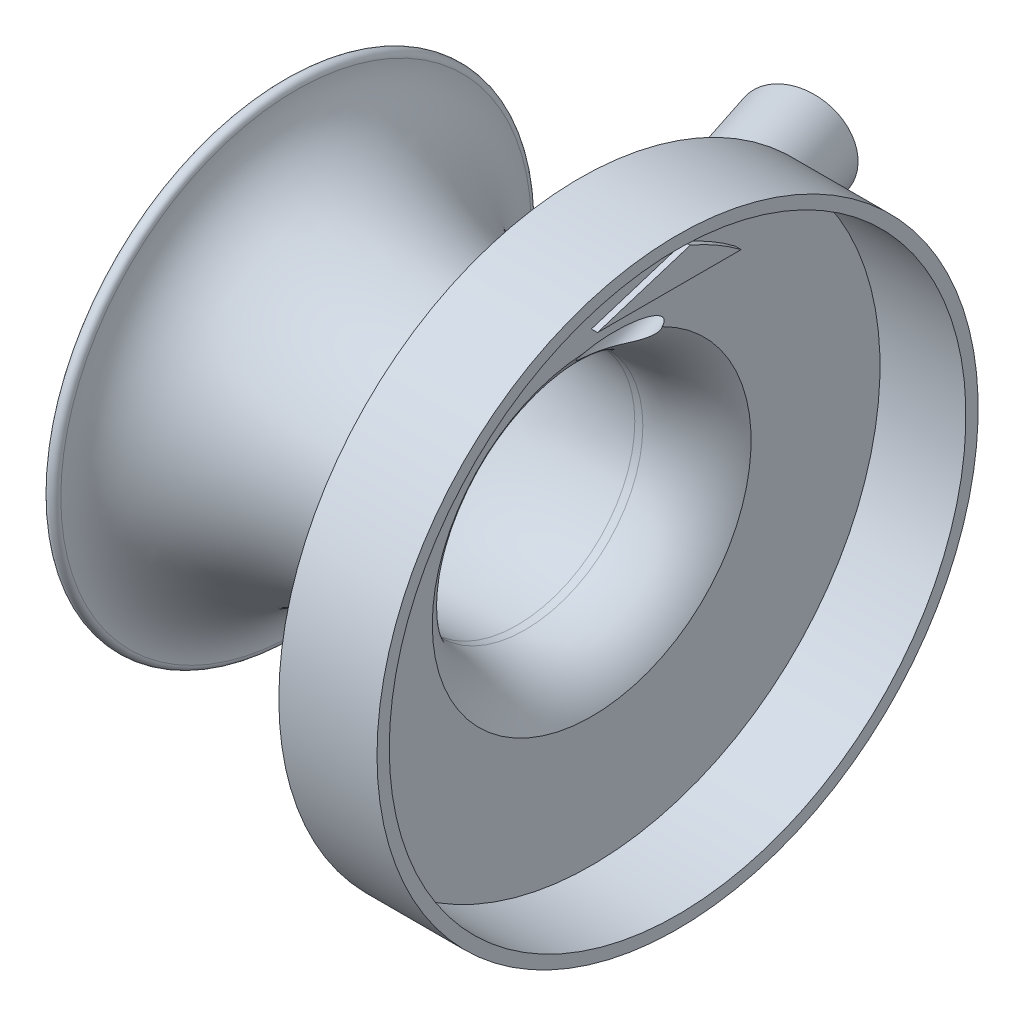
from build123d import *

# Parameters (mm, degrees)
BOSS_EXTRUDE1_REACH      = 140.716
SKETCH2_R                = 5.55625
SKETCH2_R_2              = 3.175
CUT_EXTRUDE1_DEPTH       = 139.716302058
CUT_EXTRUDE1_DEPTH_BACK  = 40.64
SKETCH2_3_R              = 3.175
BOSS_EXTRUDE3_DEPTH      = 25.4
BOSS_EXTRUDE3_DEPTH_BACK = 1.016
SKETCH2_4_R              = 10.16
SKETCH2_4_R_2            = 5.55625
BOSS_EXTRUDE4_DEPTH      = 1.27


with BuildPart() as part:
    # Sketch1 → Revolve1 (revolve)
    with BuildSketch(Plane.XY):
        with BuildLine():
            Line((-17.78, 33.403326565), (-17.78, 60.093265565))
            Line((-17.78, 60.093265565), (0, 60.093265565))
            Line((0, 60.093265565), (0, 62.633265565))
            Line((0, 62.633265565), (-20.32, 62.633265565))
            Line((-20.32, 62.633265565), (-20.32, 34.099917601))
            ThreePointArc((-20.32, 34.099917601), (-25.180755406, 29.340296974), (-31.679989745, 27.330101799))
            Line((-31.679989745, 27.330101799), (-33.2365138, 27.301858752))
            add(Edge.make_bspline(
                [(-78.987624158, 49.101480512), (-78.987360194, 48.465111349), (-78.864304013, 47.206846617), (-78.115388687, 44.647319746), (-76.172826927, 41.382782544), (-72.124745626, 37.542839726), (-66.466655311, 34.059492548), (-59.433052835, 31.146010824), (-51.317519817, 28.959245462), (-42.474533701, 27.605945243), (-36.295988449, 27.30132344), (-33.2365138, 27.301858752)],
                knots=[3.141592654, 3.141592654, 3.141592654, 3.141592654, 3.239737699, 3.337882745, 3.534172837, 3.730462929, 3.92675302, 4.123043112, 4.319333204, 4.515623295, 4.711913387, 4.711913387, 4.711913387, 4.711913387], degree=3))
            ThreePointArc((-78.987624158, 49.101480512), (-80.258150841, 50.37095361), (-81.52762394, 49.100426927))
            add(Edge.make_bspline(
                [(-81.52762394, 49.100426927), (-81.51752006, 24.741829023), (-33.213096121, 24.761865565)],
                knots=[0, 0, 0, 1.570796327, 1.570796327, 1.570796327], degree=2, weights=[1, 0.707106781, 1]))
            Line((-33.213096121, 24.761865565), (-31.579850242, 24.791500725))
            ThreePointArc((-31.579850242, 24.791500725), (-23.583053734, 27.339753754), (-17.78, 33.403326565))
        make_face()
    revolve(axis=Axis((-34.322208184, 0.403265565, 0), (1, 0, 0)))


with BuildPart() as body_2:

    # Sketch2 → Boss-Extrude1 (new, up to next)
    with BuildSketch(Plane(origin=(-13.343353817, 0, -41.066620374), x_dir=(0, -1, 0), z_dir=(-0.3090169943749514, 0, -0.9510565162951523)), mode=Mode.PRIVATE) as boss_extrude1_sk1:
        with Locations((-30.889259617, 15.45046582)):
            Circle(SKETCH2_R)
        with Locations((-30.889259617, 15.45046582)):
            Circle(SKETCH2_R_2, mode=Mode.SUBTRACT)
    boss_extrude1_tool1 = extrude(boss_extrude1_sk1.sketch, amount=-BOSS_EXTRUDE1_REACH, mode=Mode.PRIVATE) - part.part
    add(boss_extrude1_tool1.solids().sort_by_distance((-28.03762, 36.288355, -36.292164))[0])


with BuildPart() as part_1:
    add(part.part)

    # Sketch2<3> → Cut-Extrude1 (cut, two sides: drawn at the far end of the back side and taken through both)
    with BuildSketch(Plane(origin=(-13.343353817, 0, -41.066620374), x_dir=(0, -1, 0), z_dir=(-0.3090169943749514, 0, -0.9510565162951523)).offset(-CUT_EXTRUDE1_DEPTH_BACK)):
        with Locations((-30.889259617, 15.45046582)):
            Circle(SKETCH2_3_R)
    extrude(amount=CUT_EXTRUDE1_DEPTH + CUT_EXTRUDE1_DEPTH_BACK, mode=Mode.SUBTRACT)

    add(body_2.part)  # Boss-Extrude3 merges body 2
    # Sketch2<4> → Boss-Extrude3 (add, two sides: drawn at the far end of the back side and taken through both)
    with BuildSketch(Plane(origin=(-13.343353817, 0, -41.066620374), x_dir=(0, -1, 0), z_dir=(-0.3090169943749514, 0, -0.9510565162951523)).offset(-BOSS_EXTRUDE3_DEPTH_BACK)):
        with Locations((-30.889259617, 15.45046582)):
            Circle(SKETCH2_4_R)
        with Locations((-30.889259617, 15.45046582)):
            Circle(SKETCH2_4_R_2, mode=Mode.SUBTRACT)
    extrude(amount=BOSS_EXTRUDE3_DEPTH + BOSS_EXTRUDE3_DEPTH_BACK)

    # Sketch4 → Boss-Extrude4 (add)
    with BuildSketch(Plane(origin=(-17.78, 0, 0), x_dir=(0, 0, -1), z_dir=(1, 0, 0))):
        with BuildLine():
            Line((-0.069517918, 36.909368426), (19.135103568, 42.964562322))
            ThreePointArc((19.135103568, 42.964562322), (24.59426203, 40.26181388), (29.680357755, 36.909368426))
            Line((29.680357755, 36.909368426), (-0.069517918, 36.909368426))
        make_face()
    extrude(amount=BOSS_EXTRUDE4_DEPTH)


solid = part_1.part
